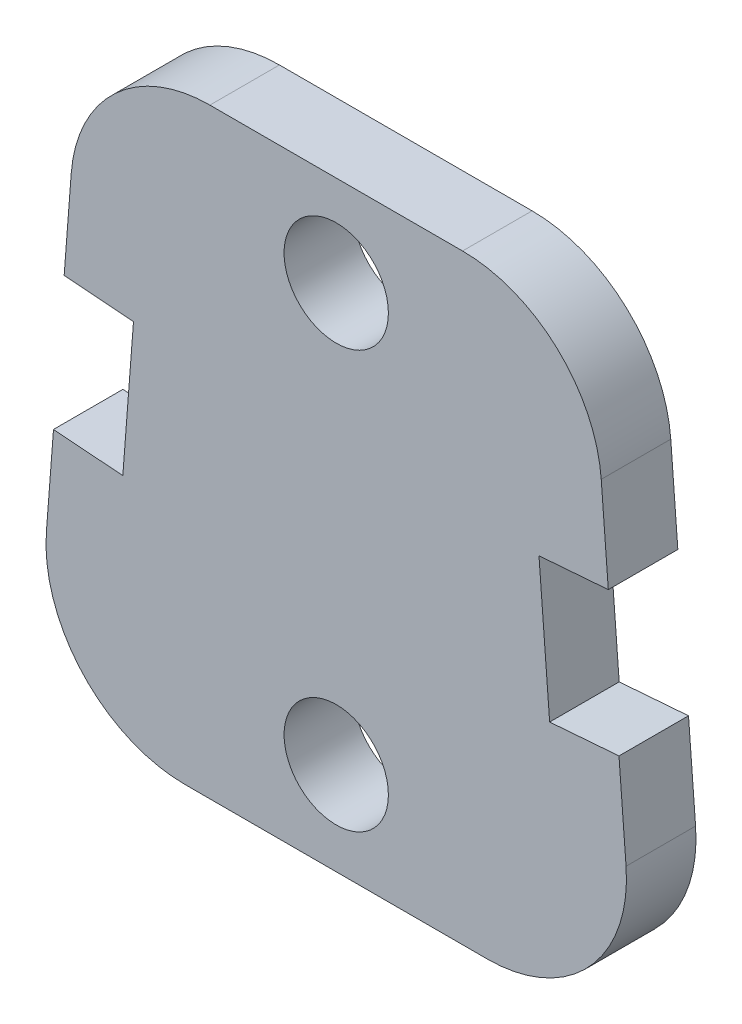
from build123d import *

# Parameters (mm, degrees)
BOSS_EXTRUDE1_DEPTH = 3.175
CAVITY1_DEPTH       = 3.175


# Read off the part's stored shape, not the designer's step: Cavity1
with BuildPart() as part:
    # Sketch1 → Boss-Extrude1 (new body)
    with BuildSketch(Plane.XY):
        with BuildLine():
            Line((-6.901112522, 27.516666667), (0, 27.516666667))
            Line((0, 27.516666667), (0, 29.368749958))
            ThreePointArc((0, 29.368749958), (-2.38125, 31.749999958), (0, 34.131249958))
            Line((0, 34.131249958), (0, 48.418749958))
            ThreePointArc((0, 48.418749958), (-2.38125, 50.799999958), (0, 53.181249958))
            Line((0, 53.181249958), (0, 54.948666667))
            Line((0, 54.948666667), (-5.767881753, 54.948666667))
            ThreePointArc((-5.767881753, 54.948666667), (-10.082386674, 53.257802562), (-12.099177736, 49.085689435))
            Line((-12.099177736, 49.085689435), (-13.232408505, 34.353689435))
            ThreePointArc((-13.232408505, 34.353689435), (-11.560248417, 29.552161746), (-6.901112522, 27.516666667))
        make_face()
        with BuildLine():
            Line((0, 29.368749958), (0, 27.516666667))
            Line((0, 27.516666667), (6.901112522, 27.516666667))
            ThreePointArc((6.901112522, 27.516666667), (11.560248417, 29.552161746), (13.232408505, 34.353689435))
            Line((13.232408505, 34.353689435), (12.099177736, 49.085689435))
            ThreePointArc((12.099177736, 49.085689435), (10.082386674, 53.257802562), (5.767881753, 54.948666667))
            Line((5.767881753, 54.948666667), (0, 54.948666667))
            Line((0, 54.948666667), (0, 53.181249958))
            ThreePointArc((0, 53.181249958), (1.683798023, 52.48379798), (2.38125, 50.799999958))
            ThreePointArc((2.38125, 50.799999958), (1.683798023, 49.116201935), (0, 48.418749958))
            Line((0, 48.418749958), (0, 34.131249958))
            ThreePointArc((0, 34.131249958), (1.683798023, 33.43379798), (2.38125, 31.749999958))
            ThreePointArc((2.38125, 31.749999958), (1.683798023, 30.066201935), (0, 29.368749958))
        make_face()
    extrude(amount=BOSS_EXTRUDE1_DEPTH)

    # Cavity1 outline → Cavity1 (cut)
    with BuildSketch(Plane.XY):
        Polygon((9.256633745, 44.641826042), (9.743656513, 38.310530059), (12.909304504, 38.554041443), (12.422281737, 44.885337426), align=None)
        Polygon((-12.909304504, 38.554041443), (-9.743656513, 38.310530059), (-9.256633745, 44.641826042), (-12.422281736, 44.885337426), align=None)
    extrude(amount=CAVITY1_DEPTH, mode=Mode.SUBTRACT)


solid = part.part
